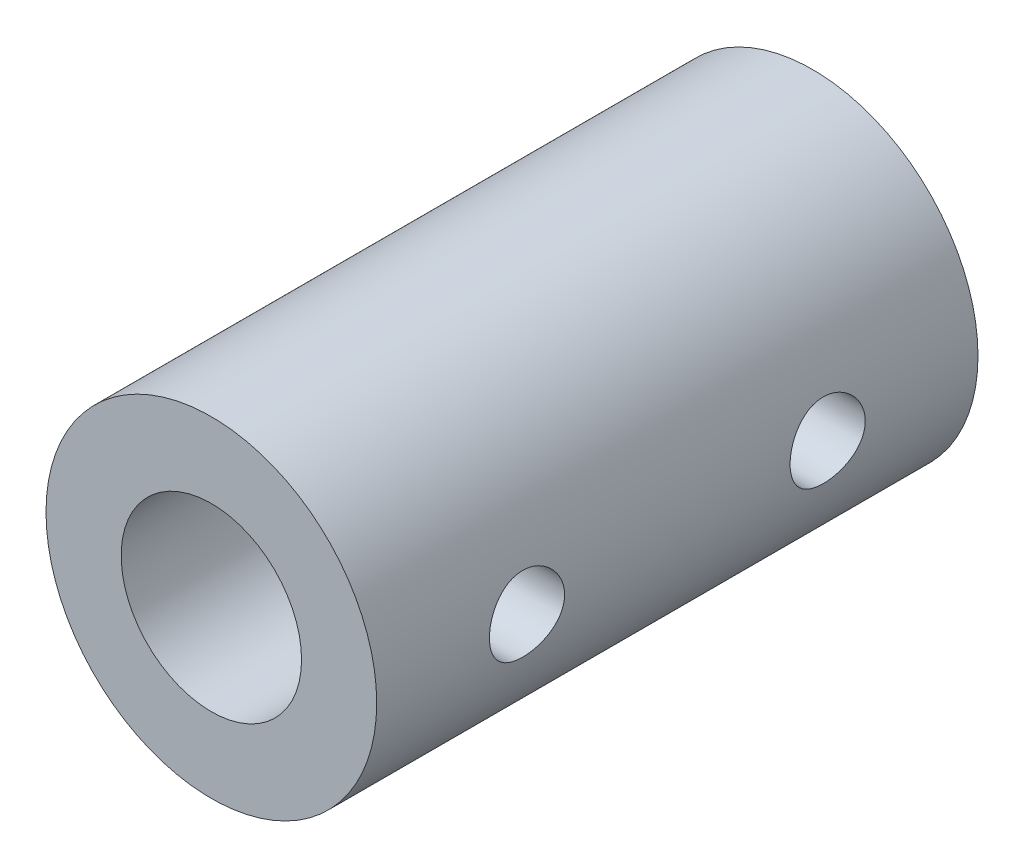
from build123d import *

# Parameters (mm, degrees)
CROQUIS1_R                     = 5.5
CROQUIS1_R_2                   = 3
SALIENTE_EXTRUIR1_DEPTH        = 20
CROQUIS4_W                     = 1.25
CROQUIS4_H                     = 5.5
TALADRO_ROSCADO_M31_AT_2_COUNT = 2
TALADRO_ROSCADO_M31_AT_2_PITCH = 10


with BuildPart() as part:
    # Croquis1 → Saliente-Extruir1 (new body)
    with BuildSketch(Plane.XY):
        Circle(CROQUIS1_R)
        Circle(CROQUIS1_R_2, mode=Mode.SUBTRACT)
    extrude(amount=SALIENTE_EXTRUIR1_DEPTH)

    # Croquis4 → Taladro roscado M31 (revolve, cut)
    with BuildSketch(Plane(origin=(0, 0, 5), x_dir=(0, 0, 1), z_dir=(0, 1, 0))):
        with Locations((0.625, 2.75)):
            Rectangle(CROQUIS4_W, CROQUIS4_H)
    taladro_roscado_m31 = revolve(axis=Axis((-6.35, 0, 5), (1, 0, 0)), mode=Mode.SUBTRACT)

    # Taladro roscado M31 at 2: Taladro roscado M31 ×2
    with Locations(*[(0, 0, i * TALADRO_ROSCADO_M31_AT_2_PITCH) for i in range(1, TALADRO_ROSCADO_M31_AT_2_COUNT)]):
        add(taladro_roscado_m31, mode=Mode.SUBTRACT)


solid = part.part
